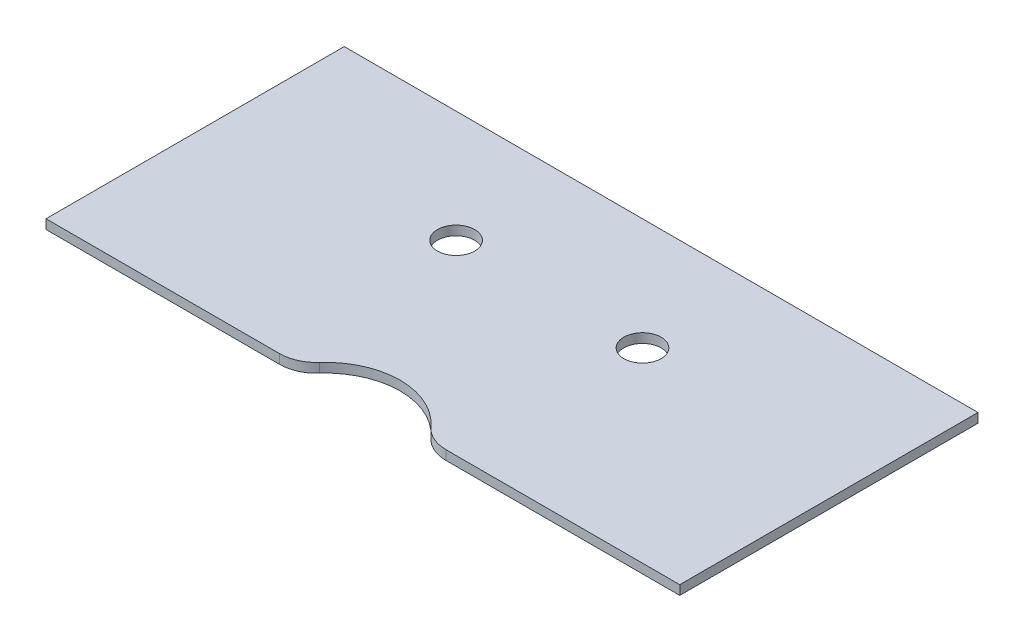
from build123d import *

# Parameters (mm, degrees)
BOSS_EXTRUDE1_DEPTH = 3.175
SKETCH2_R           = 6.35
CUT_EXTRUDE1_DEPTH  = 315.453256661
FILLET1_R           = 12.7


with BuildPart() as part:
    # Sketch1 → Boss-Extrude1 (new body)
    with BuildSketch(Plane(origin=(0, 0, 0), x_dir=(1, 0, 0), z_dir=(0, 1, 0))):
        with BuildLine():
            Line((0, 228.6), (0, 127))
            Line((0, 127), (85.952954744, 127))
            ThreePointArc((85.952954744, 127), (107.95, 139.7), (129.947045256, 127))
            Line((129.947045256, 127), (215.9, 127))
            Line((215.9, 127), (215.9, 228.6))
            Line((215.9, 228.6), (0, 228.6))
        make_face()
    extrude(amount=BOSS_EXTRUDE1_DEPTH)

    # Sketch2 → Cut-Extrude1 (cut, through all)
    with BuildSketch(Plane(origin=(0, 3.175, 0), x_dir=(1, 0, 0), z_dir=(0, 1, 0))):
        with Locations((76.2, 190.5)):
            Circle(SKETCH2_R)
        with Locations((139.7, 190.5)):
            Circle(SKETCH2_R)
    extrude(amount=-CUT_EXTRUDE1_DEPTH, mode=Mode.SUBTRACT)

    # Fillet1
    fillet1_edges = [part.edges().sort_by_distance(p)[0] for p in [
        (129.947045256, 1.5875, -127),
        (85.952954744, 1.5875, -127),
    ]]
    fillet(fillet1_edges, radius=FILLET1_R)


solid = part.part
